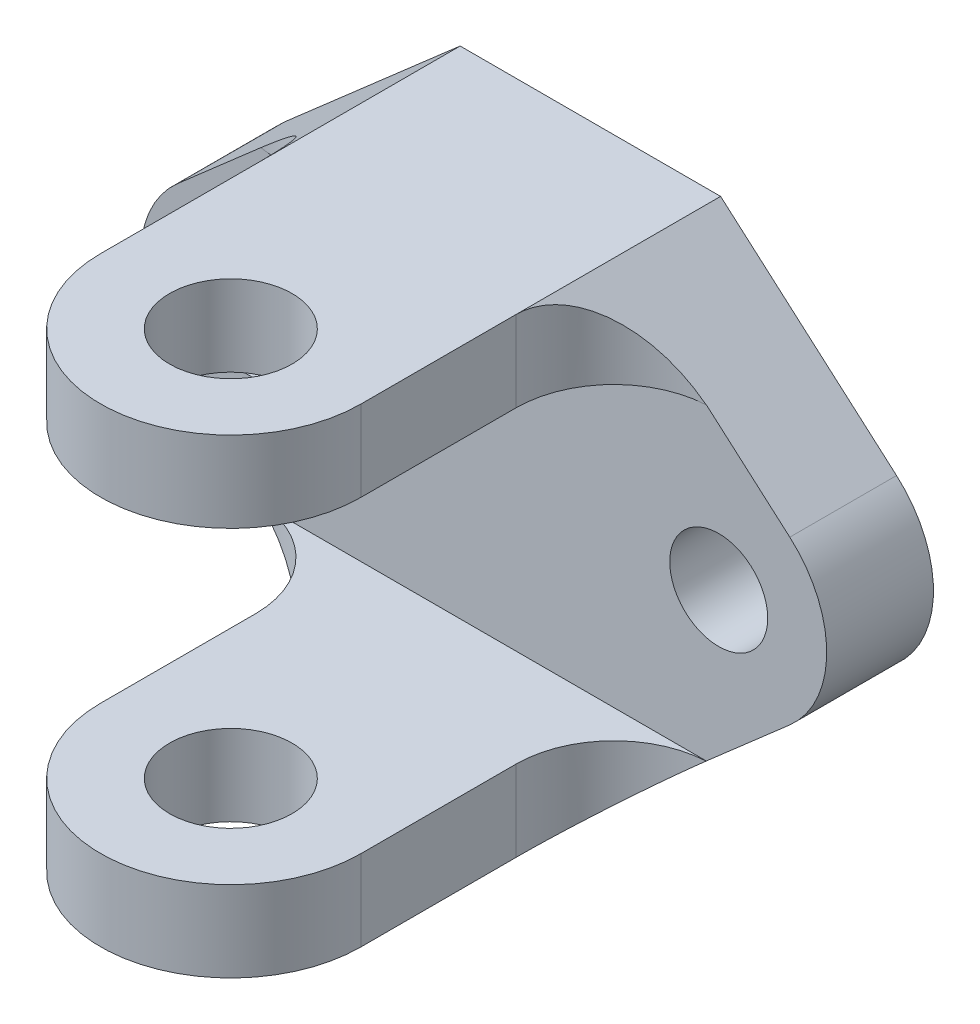
from build123d import *

# Parameters (mm, degrees)
SKETCH1_W                      = 46.48
SKETCH1_H                      = 30.48
SKETCH1_R                      = 3.175
BOSS_EXTRUDE1_DEPTH            = 9.46
SKETCH2_W                      = 46.48
SKETCH2_H                      = 5.24
BOSS_EXTRUDE2_DEPTH            = 53
CUT_EXTRUDE1_REACH             = 70.364
SKETCH4_R                      = 3.96875
CUT_EXTRUDE1_DIRECTION_2_REACH = 70.364
CUT_EXTRUDE3_REACH             = 70.364
CUT_EXTRUDE3_DIRECTION_2_REACH = 70.364
CUT_EXTRUDE4_DEPTH             = 9.46
BOSS_EXTRUDE3_DEPTH            = 9.46
FILLET3_R                      = 6.35
CUT_EXTRUDE5_DEPTH             = 2.54


with BuildPart() as part:
    # Sketch1 → Boss-Extrude1 (new body)
    with BuildSketch(Plane.XY):
        Rectangle(SKETCH1_W, SKETCH1_H)
        with Locations((15.24, 0)):
            Circle(SKETCH1_R, mode=Mode.SUBTRACT)
        with Locations((-15.24, 0)):
            Circle(SKETCH1_R, mode=Mode.SUBTRACT)
    extrude(amount=BOSS_EXTRUDE1_DEPTH)

    # Sketch2 → Boss-Extrude2 (add)
    with BuildSketch(Plane.XY.offset(9.46)):
        with Locations((0, 12.62)):
            Rectangle(SKETCH2_W, SKETCH2_H)
        with Locations((0, -12.62)):
            Rectangle(SKETCH2_W, SKETCH2_H)
    extrude(amount=BOSS_EXTRUDE2_DEPTH)

    # Cut-Extrude1: up to this face of the body (flat: up to its plane)
    cut_extrude1_end = Plane(part.part.faces().sort_by_distance((0, -15.24, 31.23))[0])
    # Sketch4 → Cut-Extrude1 (cut, up to the picked face)
    with BuildSketch(Plane(origin=(0, 0, 0), x_dir=(1, 0, 0), z_dir=(0, 1, 0)), mode=Mode.PRIVATE) as cut_extrude1_sk1:
        with Locations(Location((0, -25.8481308, 0), (0, 0, 270))):
            Circle(SKETCH4_R)
    cut_extrude1_tool1 = split(extrude(cut_extrude1_sk1.sketch, amount=-CUT_EXTRUDE1_REACH, mode=Mode.PRIVATE), bisect_by=cut_extrude1_end, keep=Keep.BOTH, mode=Mode.PRIVATE)
    add(cut_extrude1_tool1.solids().sort_by(Axis((0, 0, 25.848131), (0, -1, 0)))[0], mode=Mode.SUBTRACT)

    # Cut-Extrude1 direction 2: up to this face of the body (flat: up to its plane)
    cut_extrude1_direction_2_end = Plane(part.part.faces().sort_by_distance((0, 15.24, 31.23))[0])
    # Sketch4 → Cut-Extrude1 direction 2 (cut, up to the picked face)
    with BuildSketch(Plane(origin=(0, 0, 0), x_dir=(1, 0, 0), z_dir=(0, 1, 0)), mode=Mode.PRIVATE) as cut_extrude1_direction_2_sk1:
        with Locations(Location((0, -25.8481308, 0), (0, 0, 270))):
            Circle(SKETCH4_R)
    cut_extrude1_direction_2_tool1 = split(extrude(cut_extrude1_direction_2_sk1.sketch, amount=CUT_EXTRUDE1_DIRECTION_2_REACH, mode=Mode.PRIVATE), bisect_by=cut_extrude1_direction_2_end, keep=Keep.BOTH, mode=Mode.PRIVATE)
    add(cut_extrude1_direction_2_tool1.solids().sort_by(Axis((0, 0, 25.848131), (0, 1, 0)))[0], mode=Mode.SUBTRACT)

    # Cut-Extrude3: up to this face of the body (flat: up to its plane)
    cut_extrude3_end = Plane(part.part.faces().sort_by_distance((0, -15.24, 31.323322986))[0])
    # Sketch6 → Cut-Extrude3 (cut, up to the picked face)
    with BuildSketch(Plane(origin=(0, 0, 0), x_dir=(1, 0, 0), z_dir=(0, 1, 0)), mode=Mode.PRIVATE) as cut_extrude3_sk1:
        with BuildLine():
            Line((-8.4418692, -25.8481308), (-8.4418692, -17.46))
            Line((-8.4418692, -17.46), (-8.4418692, -9.46))
            Line((-8.4418692, -9.46), (-16.4418692, -9.46))
            Line((-16.4418692, -9.46), (-23.24, -9.46))
            Line((-23.24, -9.46), (-23.24, -62.46))
            Line((-23.24, -62.46), (23.24, -62.46))
            Line((23.24, -62.46), (23.24, -9.46))
            Line((23.24, -9.46), (16.4418692, -9.46))
            Line((16.4418692, -9.46), (8.4418692, -9.46))
            Line((8.4418692, -9.46), (8.4418692, -17.46))
            Line((8.4418692, -17.46), (8.4418692, -25.8481308))
            ThreePointArc((8.4418692, -25.8481308), (0, -34.29), (-8.4418692, -25.8481308))
        make_face()
    cut_extrude3_tool1 = split(extrude(cut_extrude3_sk1.sketch, amount=-CUT_EXTRUDE3_REACH, mode=Mode.PRIVATE), bisect_by=cut_extrude3_end, keep=Keep.BOTH, mode=Mode.PRIVATE)
    add(cut_extrude3_tool1.solids().sort_by(Axis((0, 0, 38.753518), (0, -1, 0)))[0], mode=Mode.SUBTRACT)

    # Cut-Extrude3 direction 2: up to this face of the body (flat: up to its plane)
    cut_extrude3_direction_2_end = Plane(part.part.faces().sort_by_distance((0, 15.24, 31.323322986))[0])
    # Sketch6 → Cut-Extrude3 direction 2 (cut, up to the picked face)
    with BuildSketch(Plane(origin=(0, 0, 0), x_dir=(1, 0, 0), z_dir=(0, 1, 0)), mode=Mode.PRIVATE) as cut_extrude3_direction_2_sk1:
        with BuildLine():
            Line((-8.4418692, -25.8481308), (-8.4418692, -17.46))
            Line((-8.4418692, -17.46), (-8.4418692, -9.46))
            Line((-8.4418692, -9.46), (-16.4418692, -9.46))
            Line((-16.4418692, -9.46), (-23.24, -9.46))
            Line((-23.24, -9.46), (-23.24, -62.46))
            Line((-23.24, -62.46), (23.24, -62.46))
            Line((23.24, -62.46), (23.24, -9.46))
            Line((23.24, -9.46), (16.4418692, -9.46))
            Line((16.4418692, -9.46), (8.4418692, -9.46))
            Line((8.4418692, -9.46), (8.4418692, -17.46))
            Line((8.4418692, -17.46), (8.4418692, -25.8481308))
            ThreePointArc((8.4418692, -25.8481308), (0, -34.29), (-8.4418692, -25.8481308))
        make_face()
    cut_extrude3_direction_2_tool1 = split(extrude(cut_extrude3_direction_2_sk1.sketch, amount=CUT_EXTRUDE3_DIRECTION_2_REACH, mode=Mode.PRIVATE), bisect_by=cut_extrude3_direction_2_end, keep=Keep.BOTH, mode=Mode.PRIVATE)
    add(cut_extrude3_direction_2_tool1.solids().sort_by(Axis((0, 0, 38.753518), (0, 1, 0)))[0], mode=Mode.SUBTRACT)

    # Sketch7 → Cut-Extrude4 (cut)
    with BuildSketch(Plane.XY):
        with BuildLine():
            ThreePointArc((-15.24, -7), (-22.24, 0), (-15.24, 7))
            Line((-15.24, 7), (-8.4418692, 7))
            Line((-8.4418692, 7), (-8.4418692, 15.24))
            Line((-8.4418692, 15.24), (-23.24, 15.24))
            Line((-23.24, 15.24), (-23.24, -15.24))
            Line((-23.24, -15.24), (-8.4418692, -15.24))
            Line((-8.4418692, -15.24), (-8.4418692, -7))
            Line((-8.4418692, -7), (-15.24, -7))
        make_face()
        with BuildLine():
            Line((8.4418692, 15.24), (8.4418692, 7))
            Line((8.4418692, 7), (15.24, 7))
            ThreePointArc((15.24, 7), (22.24, 0), (15.24, -7))
            Line((15.24, -7), (8.4418692, -7))
            Line((8.4418692, -7), (8.4418692, -15.24))
            Line((8.4418692, -15.24), (23.24, -15.24))
            Line((23.24, -15.24), (23.24, 15.24))
            Line((23.24, 15.24), (8.4418692, 15.24))
        make_face()
    extrude(amount=CUT_EXTRUDE4_DEPTH, mode=Mode.SUBTRACT)

    # Sketch8 → Boss-Extrude3 (add)
    with BuildSketch(Plane.XY):
        with BuildLine():
            Line((8.4418692, -15.24), (19.846982329, -5.27026696))
            ThreePointArc((19.846982329, -5.27026696), (17.700501096, -6.553314761), (15.24, -7))
            Line((15.24, -7), (8.4418692, -7))
            Line((8.4418692, -7), (8.4418692, -15.24))
        make_face()
        with BuildLine():
            ThreePointArc((-19.846982329, -5.27026696), (-17.700501096, -6.553314761), (-15.24, -7))
            Line((-15.24, -7), (-8.4418692, -7))
            Line((-8.4418692, -7), (-8.4418692, -15.24))
            Line((-8.4418692, -15.24), (-19.846982329, -5.27026696))
        make_face()
        with BuildLine():
            Line((8.4418692, 15.24), (19.846982329, 5.27026696))
            ThreePointArc((19.846982329, 5.27026696), (17.700501096, 6.553314761), (15.24, 7))
            Line((15.24, 7), (8.4418692, 7))
            Line((8.4418692, 7), (8.4418692, 15.24))
        make_face()
        with BuildLine():
            Line((-8.4418692, 15.24), (-19.846982329, 5.27026696))
            ThreePointArc((-19.846982329, 5.27026696), (-17.700501096, 6.553314761), (-15.24, 7))
            Line((-15.24, 7), (-8.4418692, 7))
            Line((-8.4418692, 7), (-8.4418692, 15.24))
        make_face()
    extrude(amount=BOSS_EXTRUDE3_DEPTH)

    # Fillet3
    # the kernel refuses this fillet: 6.35 mm, written as the material it adds along each edge
    with BuildSketch(Plane(origin=(8.4418692, -10, 9.46), x_dir=(0, 0, 1), z_dir=(0, -1, 0))) as fillet3_piece_1_section:
        with BuildLine():
            CenterArc((FILLET3_R, -FILLET3_R), FILLET3_R, 90, 90)
            Line((0, -FILLET3_R), (0, 0))
            Line((0, 0), (FILLET3_R, 0))
        make_face()
    fillet3_piece_1 = extrude(amount=5.24, mode=Mode.PRIVATE)
    fillet3_piece_1 = split(fillet3_piece_1, bisect_by=Plane(origin=(10.547300474, -13.399545855, 11.138669317), z_dir=(-0.6581403326503757, 0.7528952799286586, 0)), keep=Keep.TOP, mode=Mode.PRIVATE)
    add(fillet3_piece_1)
    with BuildSketch(Plane(origin=(-8.4418692, -10, 9.46), x_dir=(0, 0, 1), z_dir=(0, -1, 0))) as fillet3_piece_2_section:
        with BuildLine():
            CenterArc((FILLET3_R, FILLET3_R), FILLET3_R, 180, 90)
            Line((0, FILLET3_R), (0, 0))
            Line((0, 0), (FILLET3_R, 0))
        make_face()
    fillet3_piece_2 = extrude(amount=5.24, mode=Mode.PRIVATE)
    fillet3_piece_2 = split(fillet3_piece_2, bisect_by=Plane(origin=(-10.547300474, -13.399545855, 11.138669317), z_dir=(0.6581403326503753, 0.7528952799286588, 0)), keep=Keep.TOP, mode=Mode.PRIVATE)
    add(fillet3_piece_2)
    with BuildSketch(Plane(origin=(8.4418692, 10, 9.46), x_dir=(1, 0, 0), z_dir=(0, 1, 0))) as fillet3_piece_3_section:
        with BuildLine():
            CenterArc((FILLET3_R, -FILLET3_R), FILLET3_R, 90, 90)
            Line((0, -FILLET3_R), (0, 0))
            Line((0, 0), (FILLET3_R, 0))
        make_face()
    fillet3_piece_3 = extrude(amount=5.24, mode=Mode.PRIVATE)
    fillet3_piece_3 = split(fillet3_piece_3, bisect_by=Plane(origin=(10.547300473, 13.399545855, 11.138669317), z_dir=(-0.6581403326503754, -0.7528952799286586, 0)), keep=Keep.TOP, mode=Mode.PRIVATE)
    add(fillet3_piece_3)
    with BuildSketch(Plane(origin=(-8.4418692, 10, 9.46), x_dir=(-1, 0, 0), z_dir=(0, 1, 0))) as fillet3_piece_4_section:
        with BuildLine():
            CenterArc((FILLET3_R, FILLET3_R), FILLET3_R, 180, 90)
            Line((0, FILLET3_R), (0, 0))
            Line((0, 0), (FILLET3_R, 0))
        make_face()
    fillet3_piece_4 = extrude(amount=5.24, mode=Mode.PRIVATE)
    fillet3_piece_4 = split(fillet3_piece_4, bisect_by=Plane(origin=(-10.547300473, 13.399545855, 11.138669317), z_dir=(0.6581403326503757, -0.7528952799286586, 0)), keep=Keep.TOP, mode=Mode.PRIVATE)
    add(fillet3_piece_4)

    # Sketch10 → Cut-Extrude5 (cut)
    with BuildSketch(Plane.XY):
        with BuildLine():
            Line((-8.4418692, 15.24), (-19.846982329, 5.27026696))
            ThreePointArc((-19.846982329, 5.27026696), (-22.24, 0), (-19.846982329, -5.27026696))
            Line((-19.846982329, -5.27026696), (-8.4418692, -15.24))
            Line((-8.4418692, -15.24), (8.4418692, -15.24))
            Line((8.4418692, -15.24), (19.846982329, -5.27026696))
            ThreePointArc((19.846982329, -5.27026696), (22.24, 0), (19.846982329, 5.27026696))
            Line((19.846982329, 5.27026696), (8.4418692, 15.24))
            Line((8.4418692, 15.24), (-8.4418692, 15.24))
        make_face()
    extrude(amount=CUT_EXTRUDE5_DEPTH, mode=Mode.SUBTRACT)


solid = part.part
